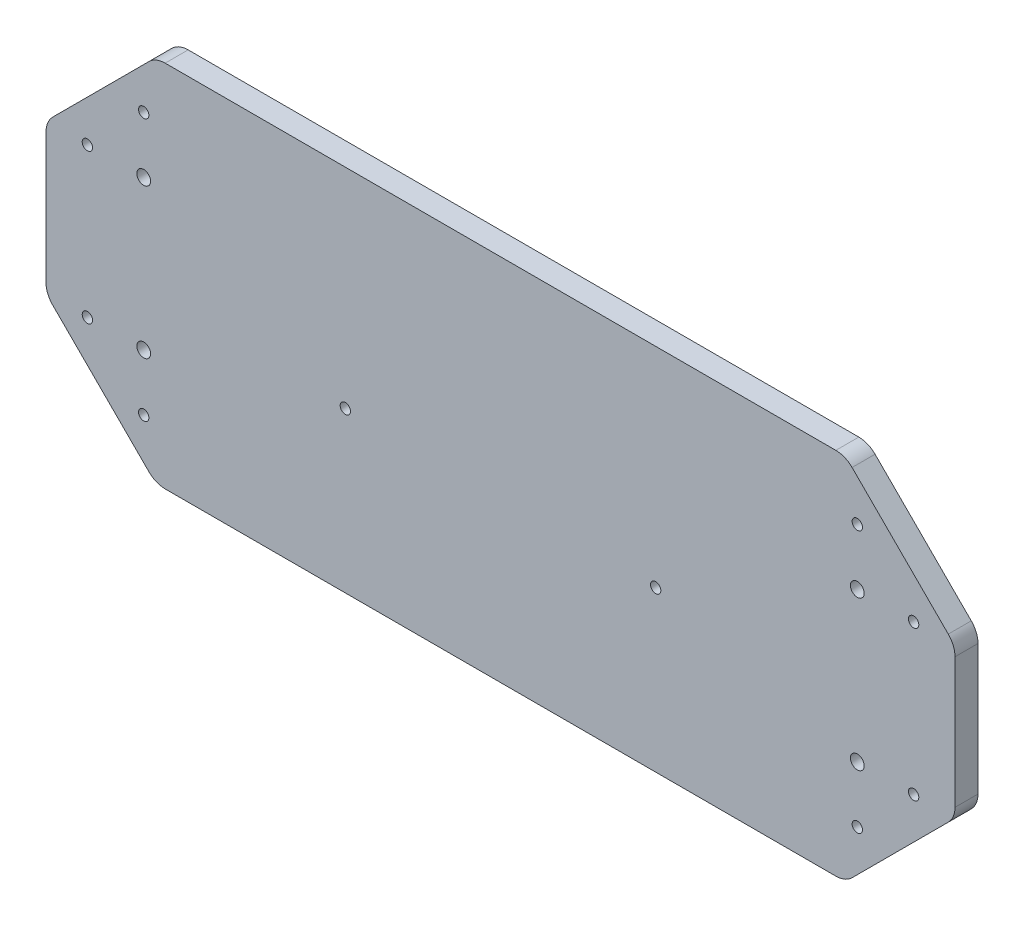
from build123d import *

# Parameters (mm, degrees)
BOSS_EXTRU_1_DEPTH      = 10
ESQUISSE3_R             = 2.25
ESQUISSE3_R_2           = 3
ENL_V_MAT_EXTRU_1_DEPTH = 10
ESQUISSE4_R             = 2.25
ENL_V_MAT_EXTRU_2_DEPTH = 10
CONG_1_R                = 10
CONG_2_R                = 10


with BuildPart() as part:
    # Esquisse1 → Boss.-Extru.1 (new body)
    with BuildSketch(Plane.XY):
        Polygon((-150, 80.2), (-197.7, 32.5), (-197.7, -32.5), (-150, -80.2), (150, -80.2), (197.7, -32.5), (197.7, 32.5), (150, 80.2), align=None)
    extrude(amount=BOSS_EXTRU_1_DEPTH)

    # Esquisse3 → Enlèv. mat.-Extru.1 (cut)
    with BuildSketch(Plane.XY.offset(10)):
        with Locations((-179.7, 32.5)):
            Circle(ESQUISSE3_R)
        with Locations((-155.2, 32.5)):
            Circle(ESQUISSE3_R_2)
        with Locations((-155.2, 57)):
            Circle(ESQUISSE3_R)
        with Locations((-155.2, -32.5)):
            Circle(ESQUISSE3_R_2)
        with Locations((-179.7, -32.5)):
            Circle(ESQUISSE3_R)
        with Locations((-155.2, -57)):
            Circle(ESQUISSE3_R)
        with Locations((155.2, -32.5)):
            Circle(ESQUISSE3_R_2)
        with Locations((179.7, -32.5)):
            Circle(ESQUISSE3_R)
        with Locations((155.2, -57)):
            Circle(ESQUISSE3_R)
        with Locations((155.2, 32.5)):
            Circle(ESQUISSE3_R_2)
        with Locations((179.7, 32.5)):
            Circle(ESQUISSE3_R)
        with Locations((155.2, 57)):
            Circle(ESQUISSE3_R)
    extrude(amount=-ENL_V_MAT_EXTRU_1_DEPTH, mode=Mode.SUBTRACT)

    # Esquisse4 → Enlèv. mat.-Extru.2 (cut)
    with BuildSketch(Plane.XY.offset(10)):
        with Locations((-67.5, -10.7)):
            Circle(ESQUISSE4_R)
        with Locations((67.5, -10.7)):
            Circle(ESQUISSE4_R)
    extrude(amount=-ENL_V_MAT_EXTRU_2_DEPTH, mode=Mode.SUBTRACT)

    # Congé1
    cong_1_edges = [part.edges().sort_by_distance(p)[0] for p in [
        (-150, 80.2, 5),
        (150, 80.2, 5),
        (150, -80.2, 5),
        (-150, -80.2, 5),
    ]]
    fillet(cong_1_edges, radius=CONG_1_R)

    # Congé2
    cong_2_edges = [part.edges().sort_by_distance(p)[0] for p in [
        (-197.7, -32.5, 5),
        (-197.7, 32.5, 5),
        (197.7, -32.5, 5),
        (197.7, 32.5, 5),
    ]]
    fillet(cong_2_edges, radius=CONG_2_R)


solid = part.part
